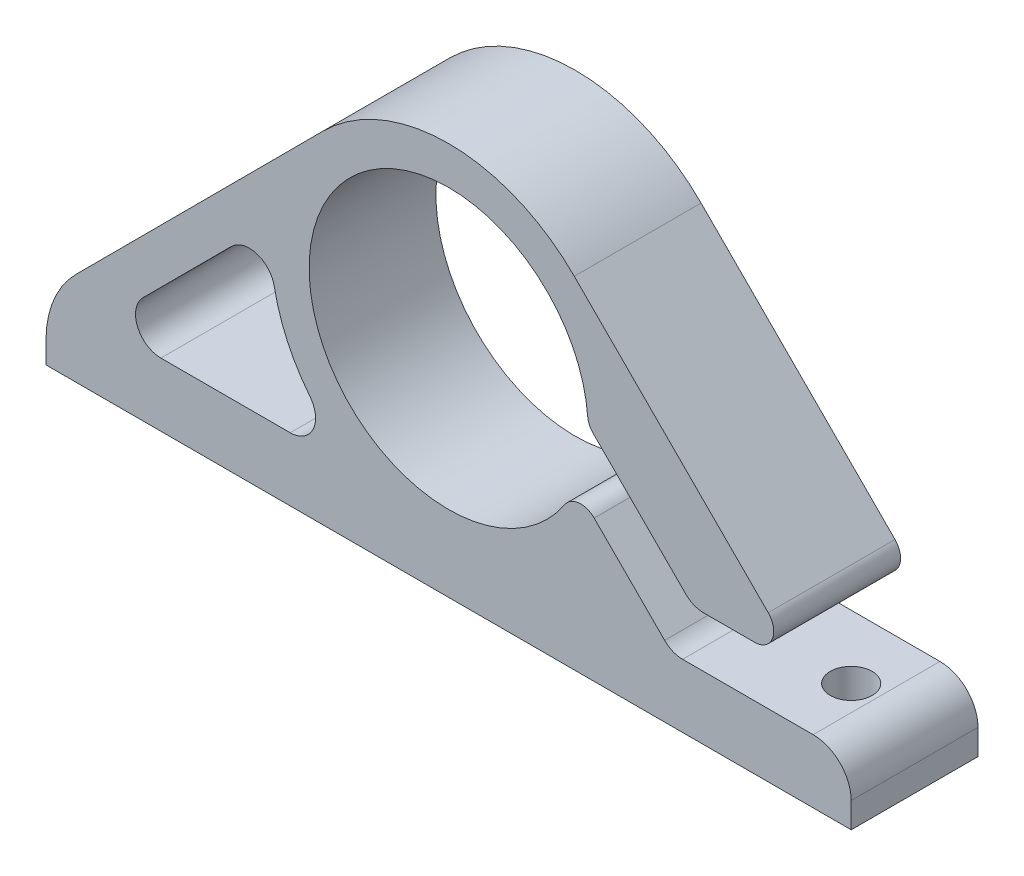
from build123d import *

# Parameters (mm, degrees)
SKETCH_1_R          = 11
EXTRUDE_1_DEPTH     = 10
CUT_EXTRUDE_1_DEPTH = 38.37729926
FILLET_1_R          = 1.5
M4X0_71_D           = 3.3
M4X0_71_DEPTH       = 5
M4X0_71_TIP         = 0.991420021
FILLET_2_R          = 3
CUT_EXTRUDE_2_DEPTH = 38.37729926
FILLET_3_R          = 2
FILLET_5_R          = 8
FILLET_6_R          = 2


with BuildPart() as part:
    # Эскиз1 → Бобышка-Вытянуть1 (new body)
    with BuildSketch(Plane.XY):
        with BuildLine():
            Line((-31.75, -12), (-9.910576673, 9.888400781))
            ThreePointArc((-9.910576673, 9.888400781), (0, 14), (9.910576673, 9.888400781))
            Line((9.910576673, 9.888400781), (31.75, -12))
            Line((31.75, -12), (31.75, -17))
            Line((31.75, -17), (-31.75, -17))
            Line((-31.75, -17), (-31.75, -12))
        make_face()
        Circle(SKETCH_1_R, mode=Mode.SUBTRACT)
    extrude(amount=EXTRUDE_1_DEPTH)

    # Эскиз2 → Вырез-Вытянуть1 (cut, through all)
    with BuildSketch(Plane.XY.offset(10)):
        Polygon((10.995743008, 0.305999515), (19.28315703, -8), (31.75, -8), (31.75, -12), (17.623677727, -12), (10.069161618, -4.428542008), align=None)
    extrude(amount=-CUT_EXTRUDE_1_DEPTH, mode=Mode.SUBTRACT)

    # Скругление1
    fillet_1_edges = [part.edges().sort_by_distance(p)[0] for p in [
        (27.758950394, -8, 5),
        (10.069161618, -4.428542008, 5),
        (10.995743008, 0.305999515, 5),
    ]]
    fillet(fillet_1_edges, radius=FILLET_1_R)

    # Отверстие обработанное метчиком M4x0.71
    with Locations(Plane(origin=(0, -17, 0), x_dir=(-1, 0, 0), z_dir=(0, -1, 0))):
        with Locations((26.75, -5), (-26.75, -5)):
            Hole(M4X0_71_D / 2, depth=M4X0_71_DEPTH)
            with Locations((0, 0, -(M4X0_71_DEPTH + M4X0_71_TIP / 2))):  # 118° drill point
                Cone(0, M4X0_71_D / 2, M4X0_71_TIP, mode=Mode.SUBTRACT)

    # Скругление2
    fillet_2_edges = [part.edges().sort_by_distance(p)[0] for p in [
        (31.75, -12, 5),
    ]]
    fillet(fillet_2_edges, radius=FILLET_2_R)

    # Эскиз11 → Вырез-Вытянуть2 (cut, through all)
    with BuildSketch(Plane.XY.offset(10)):
        with BuildLine():
            Line((-13.9037433, 1.638878353), (-24.107110728, -8.587371317))
            ThreePointArc((-24.107110728, -8.587371317), (-24.53864421, -10.766401538), (-22.69131406, -12))
            Line((-22.69131406, -12), (-7.211102551, -12))
            ThreePointArc((-7.211102551, -12), (-12.568370201, -6.167339012), (-13.9037433, 1.638878353))
        make_face()
    extrude(amount=-CUT_EXTRUDE_2_DEPTH, mode=Mode.SUBTRACT)

    # Скругление3
    fillet_3_edges = [part.edges().sort_by_distance(p)[0] for p in [
        (-7.211102551, -12, 5),
        (-13.9037433, 1.638878353, 5),
    ]]
    fillet(fillet_3_edges, radius=FILLET_3_R)

    # Скругление5
    fillet_5_edges = [part.edges().sort_by_distance(p)[0] for p in [
        (-31.75, -12, 5),
    ]]
    fillet(fillet_5_edges, radius=FILLET_5_R)

    # Скругление6
    fillet_6_edges = [part.edges().sort_by_distance(p)[0] for p in [
        (19.28315703, -8, 5),
        (17.623677727, -12, 5),
    ]]
    fillet(fillet_6_edges, radius=FILLET_6_R)


solid = part.part
